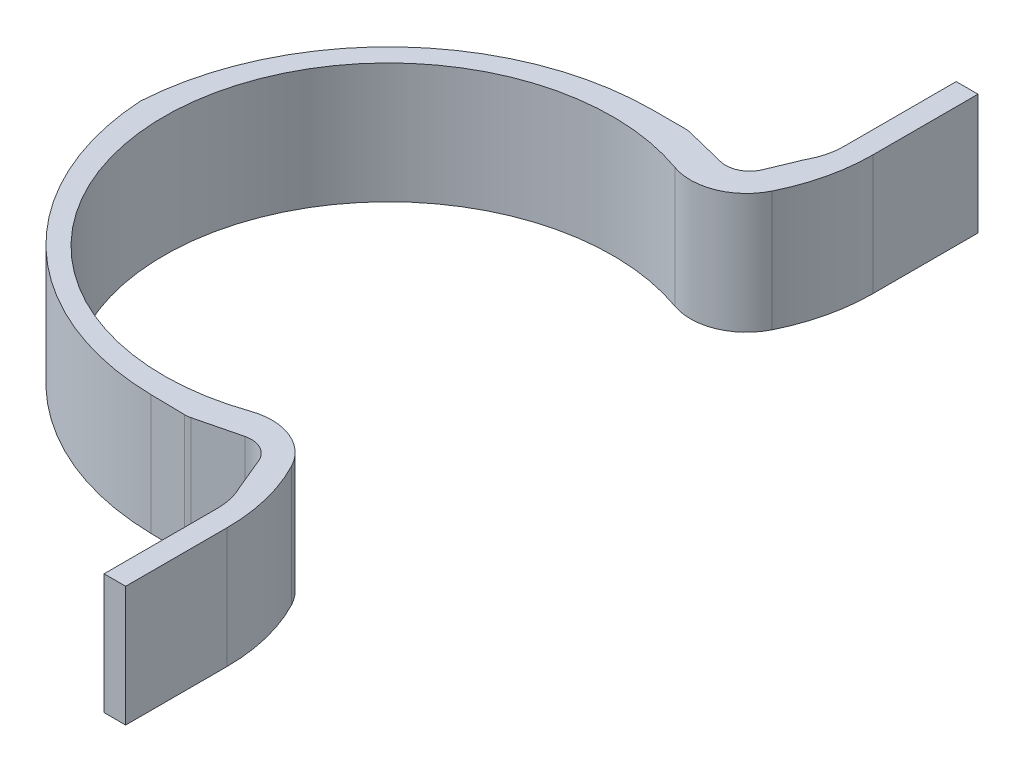
from build123d import *

# Parameters (mm, degrees)
BOSS_EXTRUDE1_DEPTH = 15
FILLET1_R           = 33
FILLET3_R           = 8
SKETCH3_W           = 14.976754218
SKETCH3_H           = 50.502927364
CUT_EXTRUDE1_DEPTH  = 71.805882398
FILLET4_R           = 13
FILLET5_R           = 23
CUT_EXTRUDE2_DEPTH  = 71.805882398
FILLET6_R           = 3
FILLET7_R           = 7
SKETCH11_R          = 2.99322587
BOSS_EXTRUDE3_DEPTH = 3
SKETCH12_R          = 3.00628595
BOSS_EXTRUDE4_DEPTH = 3
FILLET15_R          = 2


with BuildPart() as part:
    # Sketch1 → Boss-Extrude1 (new body)
    with BuildSketch(Plane(origin=(0, 0, 0), x_dir=(1, 0, 0), z_dir=(0, 1, 0))):
        with BuildLine():
            Line((13.49710544, 37.52594122), (-35.345435735, 37.52594122))
            Line((-35.345435735, 37.52594122), (-35.345435735, -23.95909877))
            Line((-35.345435735, -23.95909877), (13.519906977, -24.812641875))
            Line((13.519906977, -24.812641875), (13.519906977, -46.812641875))
            Line((13.519906977, -46.812641875), (16.216594819, -46.812641875))
            Line((16.216594819, -46.812641875), (16.216594819, -12.903441484))
            ThreePointArc((16.216594819, -12.903441484), (-32.140827884, 6.320900922), (16.216594819, 25.545243327))
            Line((16.216594819, 25.545243327), (16.216594819, 59.52594122))
            Line((16.216594819, 59.52594122), (13.49710544, 59.52594122))
            Line((13.49710544, 59.52594122), (13.49710544, 37.52594122))
        make_face()
    extrude(amount=BOSS_EXTRUDE1_DEPTH)

    # Fillet1
    # the kernel refuses this fillet: 33 mm, written as the material it takes off along each edge
    with BuildSketch(Plane(origin=(-35.345435735, -81.071536578, 23.95909877), x_dir=(0, 0, -1), z_dir=(0, 1, 0))) as fillet1_piece_1:
        with BuildLine():
            CenterArc((FILLET1_R * 0.98268529185, -FILLET1_R), FILLET1_R, 90, 88.999302122)
            Line((-FILLET1_R * 0.0171621906577, -FILLET1_R * 0.982535415153), (0, 0))
            Line((0, 0), (FILLET1_R * 0.98268529185, 0))
        make_face()
    extrude(amount=177.143073155, mode=Mode.SUBTRACT)
    with BuildSketch(Plane(origin=(-35.345435735, -82.5, -37.52594122), x_dir=(1, 0, 0), z_dir=(0, 1, 0))) as fillet1_piece_2:
        with BuildLine():
            CenterArc((FILLET1_R, -FILLET1_R), FILLET1_R, 90, 90)
            Line((0, -FILLET1_R), (0, 0))
            Line((0, 0), (FILLET1_R, 0))
        make_face()
    extrude(amount=180, mode=Mode.SUBTRACT)

    # Fillet3
    fillet3_edges = [part.edges().sort_by_distance(p)[0] for p in [
        (13.519906977, 7.5, 24.812641875),
        (13.49710544, 7.5, -37.52594122),
    ]]
    fillet(fillet3_edges, radius=FILLET3_R)

    # Sketch3 → Cut-Extrude1 (cut, through all)
    with BuildSketch(Plane(origin=(0, 15, 0), x_dir=(1, 0, 0), z_dir=(0, 1, 0))):
        with Locations((13.189850954, 6.26949409)):
            Rectangle(SKETCH3_W, SKETCH3_H)
    extrude(amount=-CUT_EXTRUDE1_DEPTH, mode=Mode.SUBTRACT)

    # Fillet4
    fillet4_edges = [part.edges().sort_by_distance(p)[0] for p in [
        (8.063971776, 7.5, -31.520957772),
        (7.849365767, 7.5, 18.981969592),
    ]]
    fillet(fillet4_edges, radius=FILLET4_R)

    # Fillet5
    # the kernel refuses this fillet: 23 mm, written as the material it takes off along each edge
    with BuildSketch(Plane(origin=(16.216594819, -37.21201477, -31.520957772), x_dir=(-1, 0, 0), z_dir=(0, 1, 0))) as fillet5_piece_1:
        with BuildLine():
            CenterArc((23, -14.884805908), FILLET5_R, 139.671769874, 40.328230126)
            Line((0, -14.884805908), (-0.46, -14.884805908))
            Line((-0.46, -14.884805908), (-0.46, 0))
            Line((-0.46, 0), (0, 0.46))
            ThreePointArc((0, 0.46), (2.73298008, 0.46), (5.115279364, 0.297696118))
            Line((5.115279364, 0.297696118), (5.465960161, 0))
        make_face()
    extrude(amount=89.424029541, mode=Mode.SUBTRACT)
    with BuildSketch(Plane(origin=(16.216594819, 52.982840025, 18.981969592), x_dir=(-1, 0, 0), z_dir=(0, -1, 0))) as fillet5_piece_2:
        with BuildLine():
            CenterArc((23, -15.19313601), FILLET5_R, 138.656554967, 41.343445033)
            Line((0, -15.19313601), (-0.46, -15.19313601))
            Line((-0.46, -15.19313601), (-0.46, 0))
            Line((-0.46, 0), (0, 0.46))
            ThreePointArc((0, 0.46), (2.866220147, 0.46), (5.3870891, 0.30386272))
            Line((5.3870891, 0.30386272), (5.732440294, 0))
        make_face()
    extrude(amount=90.96568005, mode=Mode.SUBTRACT)

    # Sketch4 → Cut-Extrude2 (cut, through all)
    with BuildSketch(Plane(origin=(0, 15, 0), x_dir=(1, 0, 0), z_dir=(0, 1, 0))):
        Polygon((1.715705502, -24.606454949), (9.959521951, -22.566105124), (13.119950571, -30.176257645), align=None)
        Polygon((13.119950571, 43.171714726), (1.715705502, 37.60191203), (9.959521951, 35.561562205), align=None)
    extrude(amount=-CUT_EXTRUDE2_DEPTH, mode=Mode.SUBTRACT)

    # Fillet6
    # the kernel refuses this fillet: 3 mm, written as the material it adds along each edge
    with BuildSketch(Plane(origin=(9.959521951, 15, 22.566105124), x_dir=(0.38353267260391577, 0, 0.9235273082293222), z_dir=(0, -1, 0)), Plane(origin=(9.959521951, 15, -35.561562205), x_dir=(-0.9707106735613967, 0, -0.24025151036773845), z_dir=(0, -1, 0))) as fillet6_piece_1:
        with BuildLine():
            CenterArc((FILLET6_R * 0.859357235827, FILLET6_R), FILLET6_R, 188.651291771, 81.348708229)
            Line((-FILLET6_R * 0.129264883466, FILLET6_R * 0.849579571712), (0, 0))
            Line((0, 0), (FILLET6_R * 0.859357235827, 0))
        make_face()
    extrude(amount=15)
    # the kernel refuses this fillet: 3 mm, written as the material it takes off along each edge
    with BuildSketch(Plane(origin=(12.653561764, -0.262717319, 29.053216951), x_dir=(-0.3835326726039229, 0, -0.9235273082293193), z_dir=(0, 1, 0))) as fillet6_2_piece_1:
        with BuildLine():
            CenterArc((0.105086928, -3), FILLET6_R, 90, 3.716956431)
            ThreePointArc((-0.089395975, -0.00631057), (-0.044689151, -0.003280466), (0, 0))
            Line((0, 0), (0.105086928, 0))
        make_face()
    extrude(amount=15.525434639, mode=Mode.SUBTRACT)
    with BuildSketch(Plane(origin=(12.466360821, -0.41333627, -41.597903613), x_dir=(0.4833086879383824, 0, -0.8754500055190354), z_dir=(0, 1, 0))) as fillet6_2_piece_2:
        with BuildLine():
            CenterArc((0.167434819, -2.999883511), FILLET6_R, 90.504917507, 5.844127099)
            Line((-0.164320455, -0.018283532), (0, 0))
            ThreePointArc((0, 0), (0.070498871, -0.000310637), (0.140997742, 0))
        make_face()
    extrude(amount=15.826672539, mode=Mode.SUBTRACT)
    with BuildSketch(Plane(origin=(1.715705502, 15.980874738, 24.606454949), x_dir=(-0.9998474825072629, 0, -0.017464584847299507), z_dir=(0, -1, 0))) as fillet6_2_piece_3:
        with BuildLine():
            CenterArc((FILLET6_R * 0.130783298337, FILLET6_R), FILLET6_R, 255.097916944, 14.902083056)
            Line((-FILLET6_R * 0.126384628394, FILLET6_R * 0.0336332696842), (0, 0))
            Line((0, 0), (FILLET6_R * 0.130783298337, 0))
        make_face()
    extrude(amount=16.961749475, mode=Mode.SUBTRACT)
    with BuildSketch(Plane(origin=(2.022657479, 15.914333267, -37.52594122), x_dir=(0.9707106735613966, 0, 0.24025151036773865), z_dir=(0, -1, 0))) as fillet6_2_piece_4:
        with BuildLine():
            CenterArc((FILLET6_R * 0.121911102219, FILLET6_R), FILLET6_R, 256.098614822, 13.901385178)
            Line((-FILLET6_R * 0.118340408149, FILLET6_R * 0.0292893264386), (0, 0))
            Line((0, 0), (FILLET6_R * 0.121911102219, 0))
        make_face()
    extrude(amount=16.828666533, mode=Mode.SUBTRACT)

    # Fillet7
    fillet7_edges = [part.edges().sort_by_distance(p)[0] for p in [
        (10.484154524, 7.5, 18.981969592),
        (10.750634658, 7.5, -31.520957772),
    ]]
    fillet(fillet7_edges, radius=FILLET7_R)

    # Sketch11 → Boss-Extrude3 (add)
    with BuildSketch(Plane.ZY.offset(-13.519906977)):
        with Locations((39.731607941, 7.574163162)):
            Circle(SKETCH11_R)
    extrude(amount=BOSS_EXTRUDE3_DEPTH)

    # Sketch12 → Boss-Extrude4 (add)
    with BuildSketch(Plane.ZY.offset(-13.49710544)):
        with Locations((-52.589854429, 7.422107304)):
            Circle(SKETCH12_R)
    extrude(amount=BOSS_EXTRUDE4_DEPTH)

    # Fillet15
    fillet15_edges = [part.edges().sort_by_distance(p)[0] for p in [
        (10.519906977, 7.574163162, 36.738382071),
        (10.49710544, 7.422107304, -55.59614038),
    ]]
    fillet(fillet15_edges, radius=FILLET15_R)


solid = part.part
